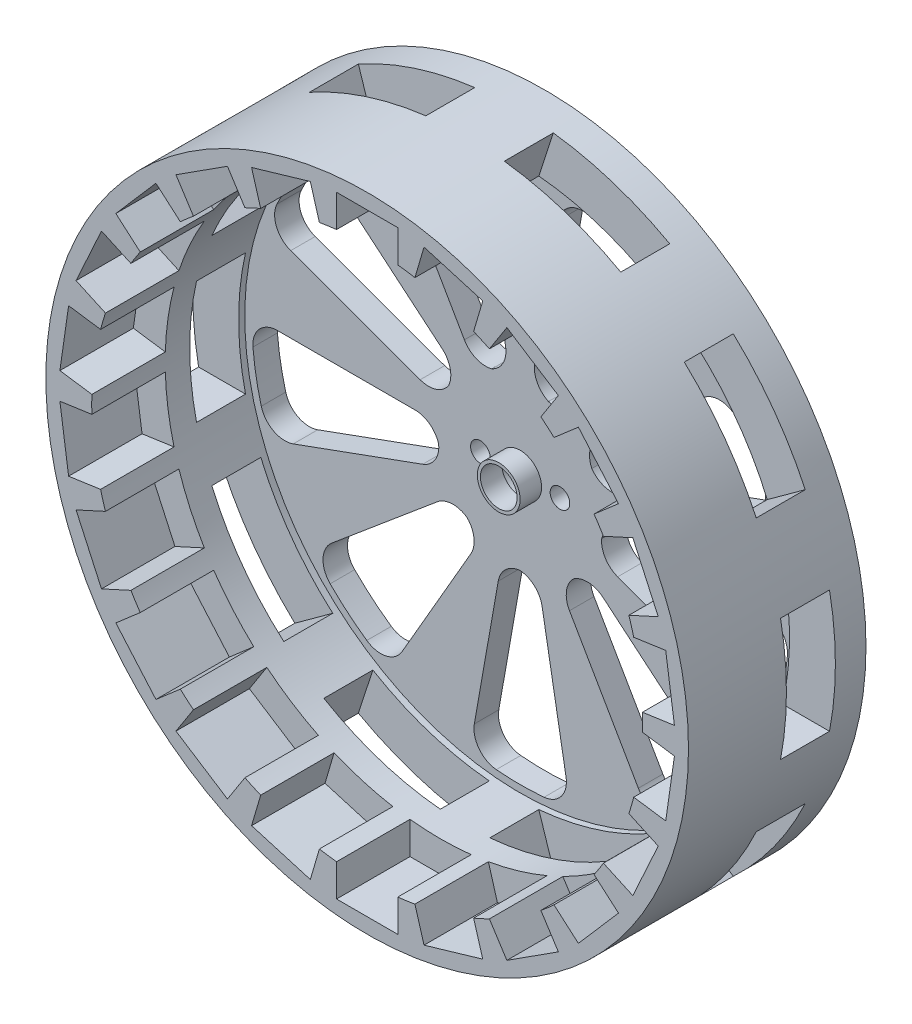
from build123d import *

# Parameters (mm, degrees)
SKETCH_1_R                       = 52.5
SKETCH_1_R_2                     = 45
EXTRUDE_1_DEPTH                  = 25
EXTRUDE_START                    = -4
SKETCH_1_2_R                     = 52.5
EXTRUDE_2_DEPTH                  = 4
SKETCH_2_R                       = 3.25
SKETCH_2_R_2                     = 1.6
CUT_EXTRUDE_1_DEPTH              = 4
SKETCH_3_R                       = 3.5
SKETCH_3_R_2                     = 3
EXTRUDE_3_DEPTH                  = 3.5
CUT_EXTRUDE_3_DEPTH              = 15
FILLET_2_R                       = 4
PATTERN_CIRCULAR_1_COUNT         = 9
FILLET_2_OF_PATTERN_CIRCULAR_1_R = 4
SKETCH_5_W                       = 10
SKETCH_5_H                       = 10
CUT_EXTRUDE_4_DEPTH              = 12
PATTERN_CIRCULAR_2_COUNT         = 22
SKETCH_7_W                       = 8
SKETCH_7_H                       = 20
CUT_EXTRUDE_5_DEPTH              = 10
PATTERN_CIRCULAR_3_COUNT         = 10


with BuildPart() as part:
    # ｽｹｯﾁ1 → ﾎﾞｽ - 押し出し1 (new body)
    with BuildSketch(Plane.XY):
        Circle(SKETCH_1_R)
        Circle(SKETCH_1_R_2, mode=Mode.SUBTRACT)
    extrude(amount=EXTRUDE_1_DEPTH)

    # ｽｹｯﾁ1<2> → ﾎﾞｽ - 押し出し2 (add)
    with BuildSketch(Plane.XY.offset(EXTRUDE_START)):
        Circle(SKETCH_1_2_R)
    extrude(amount=EXTRUDE_2_DEPTH)

    # ｽｹｯﾁ2 → ｶｯﾄ - 押し出し1 (cut)
    with BuildSketch(Plane(origin=(0, 0, -4), x_dir=(-1, 0, 0), z_dir=(0, 0, -1))):
        Circle(SKETCH_2_R)
        with Locations((6.5, 0)):
            Circle(SKETCH_2_R_2)
        with Locations((-6.5, 0)):
            Circle(SKETCH_2_R_2)
    extrude(amount=-CUT_EXTRUDE_1_DEPTH, mode=Mode.SUBTRACT)

    # ｽｹｯﾁ3 → ﾎﾞｽ - 押し出し3 (add)
    with BuildSketch(Plane.XY):
        Circle(SKETCH_3_R)
        Circle(SKETCH_3_R_2, mode=Mode.SUBTRACT)
    extrude(amount=EXTRUDE_3_DEPTH)

    # ｽｹｯﾁ4 → ｶｯﾄ - 押し出し3 (cut)
    with BuildSketch(Plane(origin=(0, 0, -4), x_dir=(-1, 0, 0), z_dir=(0, 0, -1))):
        with BuildLine():
            Line((0, -13.5), (-3, -13.5))
            Line((-3, -13.5), (-8.20944533, -43.04423259))
            ThreePointArc((-8.20944533, -43.04423259), (0, -43.82009758), (8.20944533, -43.04423259))
            Line((8.20944533, -43.04423259), (3, -13.5))
            Line((3, -13.5), (0, -13.5))
        make_face()
    cut_extrude_3 = extrude(amount=-CUT_EXTRUDE_3_DEPTH, mode=Mode.SUBTRACT)

    # ﾌｨﾚｯﾄ2
    # the kernel refuses this fillet: 4 mm, written as the material it adds along each edge
    with BuildSketch(Plane(origin=(3, -13.5, -4), x_dir=(-1, 0, 0), z_dir=(0, 0, 1))) as fillet_2_piece_1:
        with BuildLine():
            CenterArc((FILLET_2_R * 0.839099631177, FILLET_2_R), FILLET_2_R, 190, 80)
            Line((-FILLET_2_R * 0.145708121835, FILLET_2_R * 0.826351822333), (0, 0))
            Line((0, 0), (FILLET_2_R * 0.839099631177, 0))
        make_face()
    extrude(amount=4)
    with BuildSketch(Plane(origin=(-3, -13.5, -4), x_dir=(1, 0, 0), z_dir=(0, 0, 1))) as fillet_2_piece_2:
        with BuildLine():
            CenterArc((FILLET_2_R * 0.839099631177, -FILLET_2_R), FILLET_2_R, 90, 80)
            Line((-FILLET_2_R * 0.145708121835, -FILLET_2_R * 0.826351822333), (0, 0))
            Line((0, 0), (FILLET_2_R * 0.839099631177, 0))
        make_face()
    extrude(amount=4)
    with BuildSketch(Plane(origin=(-8.20944533, -43.04423259, -4), x_dir=(0.173648177666927, 0.9848077530122087, 0), z_dir=(0, 0, 1))) as fillet_2_piece_3:
        with BuildLine():
            CenterArc((4.140299508, -4), FILLET_2_R, 90, 94.883416994)
            ThreePointArc((0.154819602, -4.340514197), (0.023599921, -2.172176416), (0, 0))
            Line((0, 0), (4.140299508, 0))
        make_face()
    extrude(amount=4)
    with BuildSketch(Plane(origin=(8.20944533, -43.04423259, -4), x_dir=(-0.9903717261776532, -0.1384335363555211, 0), z_dir=(0, 0, 1))) as fillet_2_piece_4:
        with BuildLine():
            CenterArc((4.145042337, -3.995084986), FILLET_2_R, 87.159371128, 94.883416994)
            Line((0.147584394, -4.137668288), (0, 0))
            ThreePointArc((0, 0), (2.171637205, 0.053844099), (4.34327441, 0))
        make_face()
    extrude(amount=4)

    # 円形ﾊﾟﾀｰﾝ1: ｶｯﾄ - 押し出し3 ×9 about axis
    pattern_circular_1_axis = Axis((0, 0, 0), (0, 0, 1))
    for i in range(1, PATTERN_CIRCULAR_1_COUNT):
        add(cut_extrude_3.rotate(pattern_circular_1_axis, i * 360 / PATTERN_CIRCULAR_1_COUNT), mode=Mode.SUBTRACT)

    # ﾌｨﾚｯﾄ2 of 円形ﾊﾟﾀｰﾝ1
    # the kernel refuses this fillet: 4 mm, written as the material it adds along each edge
    with BuildSketch(Plane(origin=(10.97576606, -8.413237153, -4), x_dir=(0.7660444431189748, -0.6427876096865432, 0), z_dir=(0, 0, 1)), Plane(origin=(6.379499401, -12.269962811, -4), x_dir=(0.766044443118978, 0.6427876096865394, 0), z_dir=(0, 0, 1)), Plane(origin=(13.815849199, 0.610172861, -4), x_dir=(1, 0, 0), z_dir=(0, 0, 1)), Plane(origin=(12.773960133, -5.298673658, -4), x_dir=(0.17364817766693075, 0.984807753012208, 0), z_dir=(0, 0, 1)), Plane(origin=(10.191342951, 9.348076211, -4), x_dir=(0.7660444431189813, 0.6427876096865355, 0), z_dir=(0, 0, 1)), Plane(origin=(13.191342951, 4.151923789, -4), x_dir=(-0.4999999999999999, 0.8660254037844387, 0), z_dir=(0, 0, 1)), Plane(origin=(1.798194073, 13.711910811, -4), x_dir=(0.17364817766693552, 0.9848077530122071, 0), z_dir=(0, 0, 1)), Plane(origin=(7.436349797, 11.659789951, -4), x_dir=(-0.9396926207859084, 0.3420201433256685, 0), z_dir=(0, 0, 1)), Plane(origin=(-7.436349797, 11.659789951, -4), x_dir=(-0.4999999999999955, 0.8660254037844413, 0), z_dir=(0, 0, 1)), Plane(origin=(-1.798194073, 13.711910811, -4), x_dir=(-0.9396926207859082, -0.34202014332566927, 0), z_dir=(0, 0, 1)), Plane(origin=(-13.191342951, 4.151923789, -4), x_dir=(-0.9396926207859065, 0.34202014332567393, 0), z_dir=(0, 0, 1)), Plane(origin=(-10.191342951, 9.348076211, -4), x_dir=(-0.5000000000000002, -0.8660254037844385, 0), z_dir=(0, 0, 1)), Plane(origin=(-12.773960133, -5.298673658, -4), x_dir=(-0.9396926207859102, -0.3420201433256636, 0), z_dir=(0, 0, 1)), Plane(origin=(-13.815849199, 0.610172861, -4), x_dir=(0.17364817766693072, -0.984807753012208, 0), z_dir=(0, 0, 1)), Plane(origin=(-6.379499401, -12.269962811, -4), x_dir=(-0.5000000000000048, -0.8660254037844359, 0), z_dir=(0, 0, 1))) as fillet_2_of_pattern_circular_1_piece_1:
        with BuildLine():
            CenterArc((FILLET_2_OF_PATTERN_CIRCULAR_1_R * 0.839099631177, -FILLET_2_OF_PATTERN_CIRCULAR_1_R), FILLET_2_OF_PATTERN_CIRCULAR_1_R, 90, 80)
            Line((-FILLET_2_OF_PATTERN_CIRCULAR_1_R * 0.145708121835, -FILLET_2_OF_PATTERN_CIRCULAR_1_R * 0.826351822333), (0, 0))
            Line((0, 0), (FILLET_2_OF_PATTERN_CIRCULAR_1_R * 0.839099631177, 0))
        make_face()
    extrude(amount=4)
    with BuildSketch(Plane(origin=(21.379499401, -38.250724925, -4), x_dir=(0.8476521193949631, 0.530552433304407, 0), z_dir=(0, 0, 1)), Plane(origin=(40.964738756, -15.559277957, -4), x_dir=(0.30830666534341894, 0.9512870229877107, 0), z_dir=(0, 0, 1)), Plane(origin=(41.382121575, 14.412528088, -4), x_dir=(-0.3752989038692266, 0.9269038422374551, 0), z_dir=(0, 0, 1)), Plane(origin=(22.436349797, 37.640552064, -4), x_dir=(-0.8832979449787475, 0.4688120523155536, 0), z_dir=(0, 0, 1)), Plane(origin=(-7.007639403, 43.256143401, -4), x_dir=(-0.977992060869538, -0.20864210715038756, 0), z_dir=(0, 0, 1)), Plane(origin=(-33.172676245, 28.631704502, -4), x_dir=(-0.6150728223084264, -0.7884703058819317, 0), z_dir=(0, 0, 1)), Plane(origin=(-43.815849199, 0.610172861, -4), x_dir=(0.03564582558378516, -0.9993644856199615, 0), z_dir=(0, 0, 1)), Plane(origin=(-33.957099354, -27.696865444, -4), x_dir=(0.6696853955261183, -0.7426449158373243, 0), z_dir=(0, 0, 1))) as fillet_2_of_pattern_circular_1_piece_2:
        with BuildLine():
            CenterArc((4.145042337, 3.995084986), FILLET_2_OF_PATTERN_CIRCULAR_1_R, 177.957211878, 94.883416994)
            Line((0.147584394, 4.137668288), (0, 0))
            ThreePointArc((0, 0), (2.171637205, -0.053844099), (4.34327441, 0))
        make_face()
    extrude(amount=4)
    with BuildSketch(Plane(origin=(33.957099354, -27.696865444, -4), x_dir=(-0.7660444431189745, 0.6427876096865436, 0), z_dir=(0, 0, 1)), Plane(origin=(43.815849199, 0.610172861, -4), x_dir=(-1, 0, 0), z_dir=(0, 0, 1)), Plane(origin=(33.172676245, 28.631704502, -4), x_dir=(-0.7660444431189819, -0.6427876096865347, 0), z_dir=(0, 0, 1)), Plane(origin=(7.007639403, 43.256143401, -4), x_dir=(-0.1736481776669356, -0.9848077530122071, 0), z_dir=(0, 0, 1)), Plane(origin=(-22.436349797, 37.640552064, -4), x_dir=(0.49999999999999595, -0.8660254037844409, 0), z_dir=(0, 0, 1)), Plane(origin=(-41.382121575, 14.412528088, -4), x_dir=(0.9396926207859065, -0.34202014332567376, 0), z_dir=(0, 0, 1)), Plane(origin=(-40.964738756, -15.559277957, -4), x_dir=(0.9396926207859103, 0.34202014332566333, 0), z_dir=(0, 0, 1)), Plane(origin=(-21.379499401, -38.250724925, -4), x_dir=(0.5000000000000042, 0.8660254037844363, 0), z_dir=(0, 0, 1))) as fillet_2_of_pattern_circular_1_piece_3:
        with BuildLine():
            CenterArc((4.140299508, 4), FILLET_2_OF_PATTERN_CIRCULAR_1_R, 175.116583006, 94.883416994)
            ThreePointArc((0.154819602, 4.340514197), (0.023599921, 2.172176416), (0, 0))
            Line((0, 0), (4.140299508, 0))
        make_face()
    extrude(amount=4)
    with BuildSketch(Plane(origin=(-10.97576606, -8.413237153, -4), x_dir=(-0.7660444431189766, -0.6427876096865411, 0), z_dir=(0, 0, 1))) as fillet_2_of_pattern_circular_1_piece_4:
        with BuildLine():
            CenterArc((FILLET_2_OF_PATTERN_CIRCULAR_1_R * 0.839099631177, FILLET_2_OF_PATTERN_CIRCULAR_1_R), FILLET_2_OF_PATTERN_CIRCULAR_1_R, 190, 80)
            Line((-FILLET_2_OF_PATTERN_CIRCULAR_1_R * 0.145708121835, FILLET_2_OF_PATTERN_CIRCULAR_1_R * 0.826351822333), (0, 0))
            Line((0, 0), (FILLET_2_OF_PATTERN_CIRCULAR_1_R * 0.839099631177, 0))
        make_face()
    extrude(amount=4)

    # ｽｹｯﾁ5 → ｶｯﾄ - 押し出し4 (cut)
    with BuildSketch(Plane.XY.offset(25)):
        with Locations((0, 45)):
            Rectangle(SKETCH_5_W, SKETCH_5_H)
    cut_extrude_4 = extrude(amount=-CUT_EXTRUDE_4_DEPTH, mode=Mode.SUBTRACT)

    # 円形ﾊﾟﾀｰﾝ2: ｶｯﾄ - 押し出し4 ×22 about axis
    pattern_circular_2_axis = Axis((0, 0, 0), (0, 0, 1))
    for i in range(1, PATTERN_CIRCULAR_2_COUNT):
        add(cut_extrude_4.rotate(pattern_circular_2_axis, i * 360 / PATTERN_CIRCULAR_2_COUNT), mode=Mode.SUBTRACT)

    # ｽｹｯﾁ7 → ｶｯﾄ - 押し出し5 (cut)
    with BuildSketch(Plane(origin=(52.5, 0, 0), x_dir=(0, 0, -1), z_dir=(1, 0, 0))):
        with Locations((-5, 0)):
            Rectangle(SKETCH_7_W, SKETCH_7_H)
    cut_extrude_5 = extrude(amount=-CUT_EXTRUDE_5_DEPTH, mode=Mode.SUBTRACT)

    # 円形ﾊﾟﾀｰﾝ3: ｶｯﾄ - 押し出し5 ×10 about axis
    pattern_circular_3_axis = Axis((0, 0, 0), (0, 0, 1))
    for i in range(1, PATTERN_CIRCULAR_3_COUNT):
        add(cut_extrude_5.rotate(pattern_circular_3_axis, i * 360 / PATTERN_CIRCULAR_3_COUNT), mode=Mode.SUBTRACT)


solid = part.part
